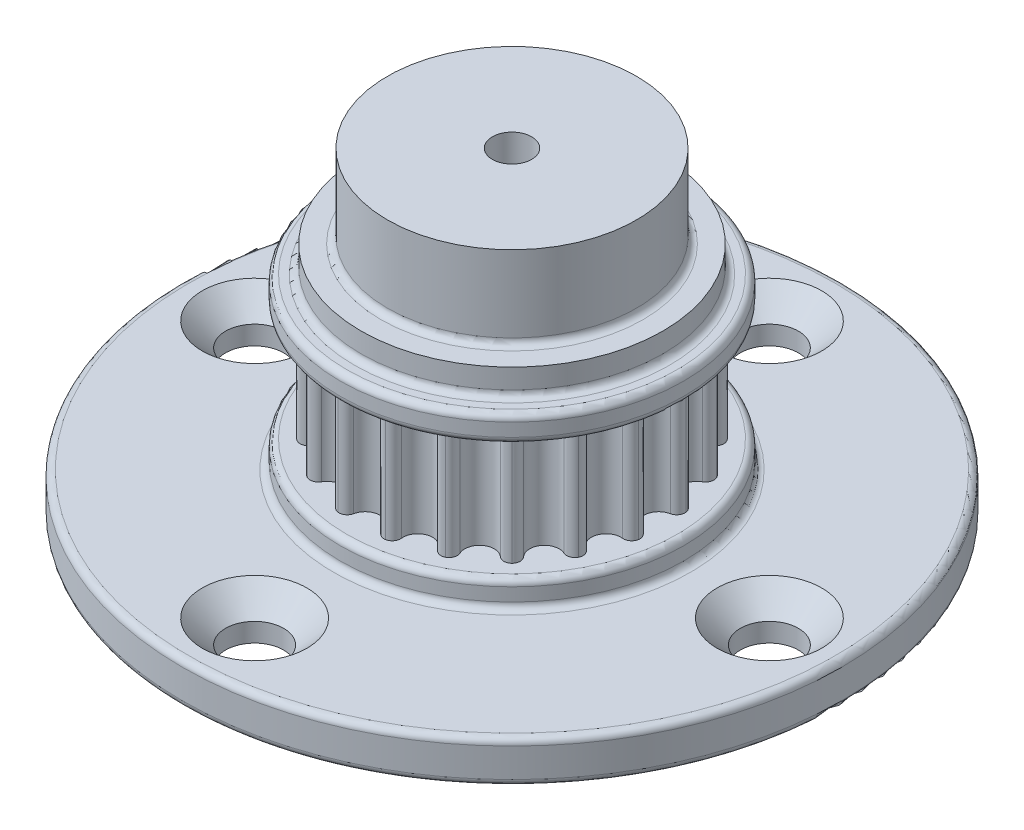
from build123d import *

# Parameters (mm, degrees)
BOSS_EXTRUDE1_DEPTH     = 3.556
CIRPATTERN1_COUNT       = 20
SKETCH9_R               = 19.84375
SKETCH9_R_2             = 1.4999999999999996
BOSS_EXTRUDE2_DEPTH     = 2.54
CUT_EXTRUDE1_DEPTH      = 30.081395842465593
CUT_EXTRUDE1_DEPTH_BACK = 30.081395842465593
SKETCH3_R               = 1.7462499999999996
SKETCH3_R_2             = 1.746249999999999
SKETCH3_R_3             = 1.7462500000000012
SKETCH3_R_4             = 1.7462499999999985
CIRPATTERN2_COUNT       = 4
CUT_EXTRUDE2_START      = -6
SKETCH11_R              = 1.5
CUT_EXTRUDE2_DEPTH      = 6
FILLET1_R               = 0.396875


with BuildPart() as part:
    # Sketch1 → Boss-Extrude1 (new, symmetric)
    with BuildSketch(Plane(origin=(0, 0, 0), x_dir=(1, 0, 0), z_dir=(0, 1, 0))):
        with BuildLine():
            ThreePointArc((0.8720606070123648, 8.659786465382457), (0.5629673031092283, 8.148255135369217), (0, 7.947579307894175))
            ThreePointArc((0, 7.947579307894175), (-1.2432753173952258, -7.8497314183622535), (2.4559370702819923, 7.558597089545281))
            ThreePointArc((2.4559370702819887, 7.558597089545281), (1.982535589248892, 7.923417606866525), (1.8466422625579257, 8.505427895318311))
            ThreePointArc((1.846642262557925, 8.505427895318311), (1.749626992044169, 8.862101959434877), (1.4341191216417435, 9.054671776489402))
            ThreePointArc((1.4341191216417435, 9.054671776489402), (1.0745459594794837, 8.96902429095141), (0.8720606070123653, 8.659786465382457))
        make_face()
    boss_extrude1 = extrude(amount=BOSS_EXTRUDE1_DEPTH, both=True)

    # CirPattern1: Boss-Extrude1 ×20 about axis
    cirpattern1_axis = Axis((0, 3.3, 0), (0, -1, 0))
    for i in range(1, CIRPATTERN1_COUNT):
        add(boss_extrude1.rotate(cirpattern1_axis, i * 360 / CIRPATTERN1_COUNT))

    # Sketch2 → Revolve3 (revolve)
    with BuildSketch(Plane(origin=(0, 0, 0), x_dir=(0, 0, -1), z_dir=(1, 0, 0))):
        Polygon((10.342329407894177, 5.087499985000001), (0, 5.087499985), (2e-16, 3.4999999849999996), (10.342329407894177, 3.499999985000001), align=None)
    revolve3 = revolve(axis=Axis((0, 3.3, 0), (0, -1, 0)))

    # Mirror1: Revolve3 across plane
    add(revolve3.mirror(Plane.ZX))

    # Sketch9 → Boss-Extrude2 (add)
    with BuildSketch(Plane.XZ.offset(5.087499985000001)):
        Circle(SKETCH9_R)
        Circle(SKETCH9_R_2, mode=Mode.SUBTRACT)
    extrude(amount=BOSS_EXTRUDE2_DEPTH)

    # Sketch3 → Cut-Extrude1 (cut, two sides: drawn at the far end of the back side and taken through both)
    with BuildSketch(Plane(origin=(0, 0, 0), x_dir=(1, 0, 0), z_dir=(0, 1, 0)).offset(-CUT_EXTRUDE1_DEPTH_BACK)):
        with Locations((-15.5, 0)):
            Circle(SKETCH3_R)
        with Locations((0, 15.500000000000002)):
            Circle(SKETCH3_R_2)
        with Locations((15.500000000000002, 0)):
            Circle(SKETCH3_R_3)
        with Locations((3.47e-15, -15.500000000000002)):
            Circle(SKETCH3_R_4)
    extrude(amount=CUT_EXTRUDE1_DEPTH + CUT_EXTRUDE1_DEPTH_BACK, mode=Mode.SUBTRACT)

    # Sketch6 → Cut-Revolve2 (revolve, cut)
    with BuildSketch(Plane.XY):
        Polygon((-11.8678, -3.499999985), (-15.5, -7.132199984999997), (-15.5, -3.499999985), align=None)
    cut_revolve2 = revolve(axis=Axis((-15.5, -7.627499985000001, 0), (0, 1, 0)), mode=Mode.SUBTRACT)

    # Sketch13 → CSK for M3 Flat Head Machine Screw1 (revolve, cut)
    with BuildSketch(Plane(origin=(-15.5, -5.087499985000001, 0), x_dir=(0, 0, 1), z_dir=(1, 0, 0))):
        Polygon((0, 0), (-6.35e-15, 25.91346305234684), (1.6999999999999862, 24.891999999999996), (1.6999999999999966, 1.4500000000000033), (3.15, -1.73e-15), align=None)
    csk_for_m3_flat_head_machine_screw1 = revolve(axis=Axis((-15.5, 1.2625000149999899, 0), (0, -1, 0)), mode=Mode.SUBTRACT)

    # CirPattern2: Cut-Revolve2, CSK for M3 Flat Head Machine Screw1 ×4 about axis
    cirpattern2_axis = Axis((0, 3.3, 0), (0, -1, 0))
    add([cut_revolve2.rotate(cirpattern2_axis, i * 360 / CIRPATTERN2_COUNT) for i in range(1, CIRPATTERN2_COUNT)], mode=Mode.SUBTRACT)
    add([csk_for_m3_flat_head_machine_screw1.rotate(cirpattern2_axis, i * 360 / CIRPATTERN2_COUNT) for i in range(1, CIRPATTERN2_COUNT)], mode=Mode.SUBTRACT)

    # Sketch11 → Cut-Extrude2 (cut)
    with BuildSketch(Plane.XZ.offset(5.087499985000001).offset(CUT_EXTRUDE2_START)):
        Circle(SKETCH11_R)
    extrude(amount=CUT_EXTRUDE2_DEPTH, mode=Mode.SUBTRACT)

    # Sketch10 → Revolve4 (revolve)
    with BuildSketch(Plane(origin=(0, 0, 0), x_dir=(0, 0, -1), z_dir=(1, 0, 0))):
        Polygon((1.1821750652977259, 6.674999985000001), (1.1821750652977259, 11.674999985), (7.499999999999998, 11.674999985), (7.499999999999999, 6.674999985000001), (9.087499999999999, 6.674999985000001), (9.087500000000002, 5.087499985000001), (1.182175065297726, 5.087499985000001), align=None)
    revolve(axis=Axis((0, 0, 0), (0, 1, 0)))

    # Fillet1
    fillet1_edges = [part.edges().sort_by_distance(p)[0] for p in [
        (1.27e-15, 5.087499985000001, 10.342329407894177),
        (1.27e-15, 3.499999985000001, 10.342329407894177),
        (-19.84375, -7.627499985000001, 2.43e-15),
        (-19.84375, -5.087499985000001, 2.43e-15),
        (-9.2e-16, 6.674999985000001, 7.499999999999999),
        (-1.11e-15, 5.087499985000001, 9.087500000000002),
        (1.27e-15, -3.499999985000001, 10.342329407894177),
        (1.27e-15, -5.087499985000001, 10.342329407894177),
    ]]
    fillet(fillet1_edges, radius=FILLET1_R)


solid = part.part
